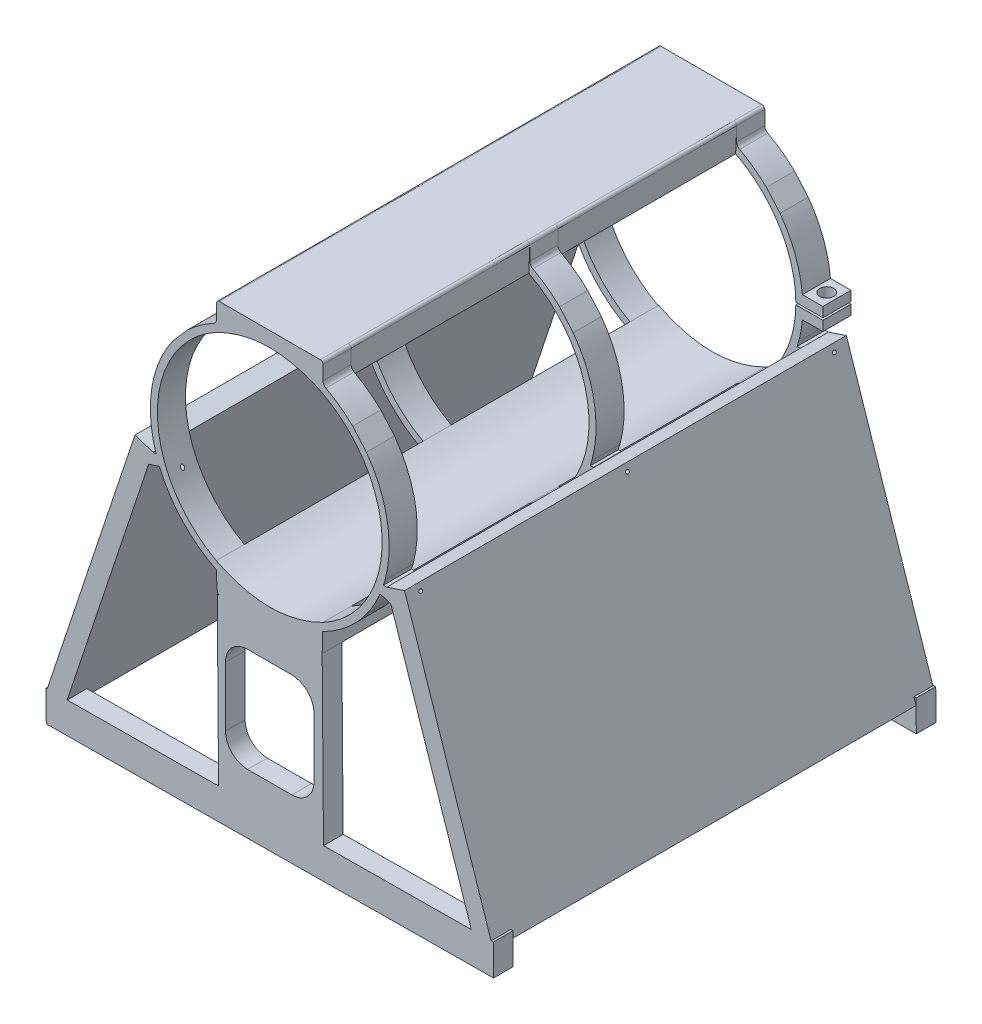
from build123d import *

# Parameters (mm, degrees)
SKETCH1_R                 = 50.8
BOSS_EXTRUDE1_DEPTH       = 12.7
LPATTERN2_COUNT           = 3
LPATTERN2_PITCH           = 93.5
BOSS_EXTRUDE3_DEPTH       = 200
BOSS_EXTRUDE5_DEPTH       = 12.7
SKETCH16_W                = 12.225802464
SKETCH16_H                = 1
CUT_EXTRUDE1_DEPTH        = 12.7
SKETCH17_R                = 3.175
CUT_EXTRUDE2_DEPTH        = 15.7
SKETCH18_W                = 47.42686664
SKETCH18_H                = 8.89
BOSS_EXTRUDE6_DEPTH       = 88.9
CUT_EXTRUDE4_DEPTH        = 18.8
FILLET2_R                 = 10
CUT_EXTRUDE5_DEPTH        = 10
FILLET6_R                 = 0.3
SKETCH26_R                = 0.7935
CUT_EXTRUDE7_DEPTH        = 2
F_1_5MM_START             = 35
F_1_5MM_DOWEL_SLOT2_DEPTH = 7.947903676
LPATTERN4_COUNT           = 3
LPATTERN4_PITCH           = 93.5
MIRROR1_COPY_1_SKETCH_R   = 0.7935
MIRROR1_COPY_1_DEPTH      = 2
MIRROR1_COPY_2_SKETCH_R   = 0.7935
MIRROR1_COPY_2_DEPTH      = 2
MIRROR1_START             = 35
MIRROR1_COPY_3_DEPTH      = 7.947903676
MIRROR1_COPY_4_DEPTH      = 7.947903676
FILLET7_R                 = 10
SKETCH36_W                = 8.89
SKETCH36_H                = 14
BOSS_EXTRUDE8_DEPTH       = 76.75
SKETCH38_W                = 8.89
SKETCH38_H                = 14
BOSS_EXTRUDE10_DEPTH      = 76.75
BOSS_EXTRUDE12_START      = -0.0001
SKETCH40_W                = 199.7
SKETCH40_H                = 127
BOSS_EXTRUDE12_DEPTH      = 8.5001
SKETCH39_W                = 8.89
SKETCH39_H                = 14
BOSS_EXTRUDE14_DEPTH      = 78
SKETCH37_W                = 8.89
SKETCH37_H                = 14
BOSS_EXTRUDE16_DEPTH      = 78
BOSS_EXTRUDE17_DEPTH      = 199.7
SKETCH55_R                = 0.826943886
CUT_EXTRUDE8_DEPTH        = 15
LPATTERN8_COUNT           = 3
LPATTERN8_PITCH           = 93.5
MIRROR6_COPY_1_SKETCH_R   = 0.826943886
MIRROR6_COPY_1_DEPTH      = 15
MIRROR6_COPY_2_SKETCH_R   = 0.826943886
MIRROR6_COPY_2_DEPTH      = 15


with BuildPart() as part:
    # Sketch1 → Boss-Extrude1 (new body)
    with BuildSketch(Plane.XY):
        with BuildLine():
            Line((-24.055294118, 56.216176471), (-24.055294118, 49.866176471))
            ThreePointArc((-24.055294118, 49.866176471), (-24.417262086, 48.559357252), (-25.4, 47.625))
            ThreePointArc((-25.4, 47.625), (-31.759819314, 43.641889305), (-37.505739075, 38.815205287))
            Line((-37.505739075, 38.815205287), (-43.659791369, 31.735205098))
            ThreePointArc((-43.659791369, 31.735205098), (-51.331461425, 16.684774284), (-53.975, 0))
            ThreePointArc((-53.975, 0), (-53.865614909, -3.434553173), (-53.537902992, -6.855185497))
            ThreePointArc((-53.537902992, -6.855185497), (-52.682569376, -11.740847882), (-51.382359151, -16.527364977))
            Line((-51.382359151, -16.527364977), (-52.86890038, -16.527364977))
            Line((-52.86890038, -16.527364977), (-54.75686071, -22.202033459))
            Line((-54.75686071, -22.202033459), (-49.884351703, -20.611940232))
            ThreePointArc((-49.884351703, -20.611940232), (0, -53.975), (49.884351703, -20.611940232))
            Line((49.884351703, -20.611940232), (54.75686071, -22.202033459))
            Line((54.75686071, -22.202033459), (52.86890038, -16.527364977))
            Line((52.86890038, -16.527364977), (51.382359151, -16.527364977))
            Line((51.382359151, -16.527364977), (52.081837881, -14.169784328))
            ThreePointArc((52.081837881, -14.169784328), (52.93636042, -10.537664373), (53.537902992, -6.855185497))
            ThreePointArc((53.537902992, -6.855185497), (53.865614909, -3.434553173), (53.975, 0))
            ThreePointArc((53.975, 0), (51.331461425, 16.684774284), (43.659791369, 31.735205098))
            Line((43.659791369, 31.735205098), (37.505739075, 38.815205287))
            ThreePointArc((37.505739075, 38.815205287), (31.759819314, 43.641889305), (25.4, 47.625))
            ThreePointArc((25.4, 47.625), (24.417262086, 48.559357252), (24.055294118, 49.866176471))
            Line((24.055294118, 49.866176471), (24.055294118, 56.216176471))
            ThreePointArc((24.055294118, 56.216176471), (23.68331973, 57.114202083), (22.785294118, 57.486176471))
            Line((22.785294118, 57.486176471), (-22.785294118, 57.486176471))
            ThreePointArc((-22.785294118, 57.486176471), (-23.68331973, 57.114202083), (-24.055294118, 56.216176471))
        make_face()
        Circle(SKETCH1_R, mode=Mode.SUBTRACT)
    extrude(amount=BOSS_EXTRUDE1_DEPTH)


with BuildPart() as lpattern2_1:
    # LPattern2: pattern copy
    add(part.part.moved(Location(Vector(0, 0, 1) * (1 * LPATTERN2_PITCH))))


with BuildPart() as lpattern2_2:
    # LPattern2: pattern copy
    add(part.part.moved(Location(Vector(0, 0, 1) * (2 * LPATTERN2_PITCH))))


with BuildPart() as part_1:
    add(part.part)

    add(lpattern2_1.part)  # Boss-Extrude3 merges LPattern2_1

    add(lpattern2_2.part)  # Boss-Extrude3 merges LPattern2_2
    # Sketch11 → Boss-Extrude3 (add)
    with BuildSketch(Plane.XY.offset(199.7)):
        with BuildLine():
            Line((23.68331973, -57.114202083), (-22.785294118, -57.486176471))
            Line((-22.785294118, -57.486176471), (-23.68331973, -57.114202083))
            Line((-23.68331973, -57.114202083), (-24.181898326, -49.07426691))
            Line((-24.181898326, -49.07426691), (-24.181898326, -44.675225723))
            add(Edge.make_bspline(
                [(-24.181898326, -44.675225723), (-0.07192549, -56.89053005), (24.055294118, -44.743522715)],
                knots=[0, 0, 0, 1, 1, 1], degree=2))
            Line((24.055294118, -44.743522715), (23.68331973, -57.114202083))
        make_face()
    extrude(amount=-BOSS_EXTRUDE3_DEPTH)

    # Sketch15 → Boss-Extrude5 (add)
    with BuildSketch(Plane(origin=(0, 0, 0), x_dir=(-1, 0, 0), z_dir=(0, 0, -1))):
        Polygon((63.023341774, -4.920509768), (63.023341774, 4.919490232), (53.750341774, 4.919490232), (53.975, 0), (53.750341774, -4.920509768), align=None)
        Polygon((-53.750341774, -4.920509768), (-53.975, 0), (-53.750341774, 4.919490232), (-63.023341774, 4.919490232), (-63.023341774, -4.920509768), align=None)
    extrude(amount=-BOSS_EXTRUDE5_DEPTH)

    # Sketch16 → Cut-Extrude1 (cut)
    with BuildSketch(Plane(origin=(0, 0, 0), x_dir=(-1, 0, 0), z_dir=(0, 0, -1))):
        with Locations((56.910440542, 0)):
            Rectangle(SKETCH16_W, SKETCH16_H)
        with Locations((-56.910440542, 0)):
            Rectangle(SKETCH16_W, SKETCH16_H)
    extrude(amount=-CUT_EXTRUDE1_DEPTH, mode=Mode.SUBTRACT)


with BuildPart() as cut_extrude1_piece_1:
    # of the separate pieces the step leaves, piece 1, a body of its own (cut_extrude1_pieces)
    add(part_1.part.solids().sort_by_distance((63.023341774, -0.5, 0))[0])


with BuildPart() as cut_extrude1_piece_2:
    # of the separate pieces the step leaves, piece 2, a body of its own (cut_extrude1_pieces)
    add(part_1.part.solids().sort_by_distance((37.505739075, 38.815205287, 0))[0])


with BuildPart() as cut_extrude2_tool:
    # Sketch17 → Cut-Extrude2 (new body)
    with BuildSketch(Plane(origin=(0, 4.919490232, 0), x_dir=(1, 0, 0), z_dir=(0, 1, 0))):
        with Locations(Location((-58.388427153, -6.35, 0), (0, 0, 270))):
            Circle(SKETCH17_R)
        with Locations(Location((58.388427153, -6.35, 0), (0, 0, 270))):
            Circle(SKETCH17_R)
    extrude(amount=-CUT_EXTRUDE2_DEPTH)


with BuildPart() as cut_extrude1_piece_1_1:
    add(cut_extrude1_piece_1.part)

    # Cut-Extrude2: cut by cut_extrude2_tool
    add(cut_extrude2_tool.part, mode=Mode.SUBTRACT)

    # Sketch18 → Boss-Extrude6 (add)
    with BuildSketch(Plane(origin=(0.458678929, -57.300111901, 0), x_dir=(0.9999679627099131, 0.00800459579154236, 0), z_dir=(0.00800459579154236, -0.9999679627099132, 0))):
        with Locations((-0.488048441, 4.145)):
            Rectangle(SKETCH18_W, SKETCH18_H)
        with Locations((-0.488048441, 195.255)):
            Rectangle(SKETCH18_W, SKETCH18_H)
    extrude(amount=BOSS_EXTRUDE6_DEPTH)

    # Sketch21 → Cut-Extrude4 (cut)
    with BuildSketch(Plane(origin=(0, 0, -0.3), x_dir=(-1, 0, 0), z_dir=(0, 0, -1))):
        Polygon((0.432638356, -73.499988034), (20.033806895, -73.499988034), (20.033806895, -98.499988034), (20.033806895, -120.499988034), (0.432638356, -120.499988034), (-19.966193105, -120.499988034), (-19.966193105, -98.499988034), (-19.966193105, -73.499988034), align=None)
    extrude(amount=-CUT_EXTRUDE4_DEPTH, mode=Mode.SUBTRACT)

    # Fillet2
    fillet2_edges = [cut_extrude1_piece_1_1.edges().sort_by_distance(p)[0] for p in [
        (19.966193105, -73.499988034, 4.145),
        (-20.033806895, -73.499988034, 4.145),
        (-20.033806895, -120.499988034, 4.145),
        (19.966193105, -120.499988034, 4.145),
    ]]
    fillet(fillet2_edges, radius=FILLET2_R)

    # Sketch22 → Cut-Extrude5 (cut)
    with BuildSketch(Plane.XY.offset(199.7)):
        Polygon((0.783736559, -72.317531488), (19.966193105, -72.317531488), (19.966193105, -98.499988034), (19.966193105, -119.317531488), (0.783736559, -119.317531488), (-20.033806895, -119.317531488), (-20.033806895, -72.317531488), align=None)
    extrude(amount=-CUT_EXTRUDE5_DEPTH, mode=Mode.SUBTRACT)

    # Fillet6
    fillet6_edges = [cut_extrude1_piece_1_1.edges().sort_by_distance(p)[0] for p in [
        (52.86890038, -16.527364977, 99.85),
    ]]
    fillet(fillet6_edges, radius=FILLET6_R)

    # Sketch26 → Cut-Extrude7 (cut)
    with BuildSketch(Plane(origin=(42.649426179, 14.189450006, 0), x_dir=(0, 0, -1), z_dir=(0.9488635217869666, 0.3156865803641875, 0))):
        with Locations(Location((-193.35, -35.362460937, 0), (0, 0, 90))):
            Circle(SKETCH26_R)
    cut_extrude7 = extrude(amount=-CUT_EXTRUDE7_DEPTH, mode=Mode.SUBTRACT)

    # Ø1.5mm Dowel Slot2: read off the stored shape, not the designer's step
    # Ø1.5mm Dowel Slot2 outline → Ø1.5mm Dowel Slot2 (cut)
    with BuildSketch(Plane(origin=(0, 0, 0), x_dir=(-0.3156865803641879, 0.9488635217869665, 0), z_dir=(0.9488635217869666, 0.3156865803641879, 0)).offset(F_1_5MM_START)):
        with BuildLine():
            ThreePointArc((-35.412460937, 194.1), (-36.162460937, 193.35), (-35.412460937, 192.6))
            Line((-35.412460937, 192.6), (-35.312460937, 192.6))
            ThreePointArc((-35.312460937, 192.6), (-34.562460937, 193.35), (-35.312460937, 194.1))
            Line((-35.312460937, 194.1), (-35.412460937, 194.1))
        make_face()
    f_1_5mm_dowel_slot2 = extrude(amount=F_1_5MM_DOWEL_SLOT2_DEPTH, mode=Mode.SUBTRACT)

    # LPattern4: Cut-Extrude7, Ø1.5mm Dowel Slot2 ×3
    with Locations(*[(0, 0, -i * LPATTERN4_PITCH) for i in range(1, LPATTERN4_COUNT)]):
        add(cut_extrude7, mode=Mode.SUBTRACT)
        add(f_1_5mm_dowel_slot2, mode=Mode.SUBTRACT)

    # Mirror1: Cut-Extrude7, Ø1.5mm Dowel Slot2 across plane
    add(cut_extrude7.mirror(Plane(origin=(0, 0, 0), x_dir=(0, 0, 1), z_dir=(1, 0, 0))), mode=Mode.SUBTRACT)
    add(f_1_5mm_dowel_slot2.mirror(Plane(origin=(0, 0, 0), x_dir=(0, 0, 1), z_dir=(1, 0, 0))), mode=Mode.SUBTRACT)

    # Mirror1 copy 1 sketch → Mirror1 copy 1 (cut)
    with BuildSketch(Plane(origin=(-42.649426179, 14.189450006, -93.5), x_dir=(0, 0, -1), z_dir=(-0.9488635217869666, 0.3156865803641875, 0))):
        with Locations((-193.35, 35.362460937)):
            Circle(MIRROR1_COPY_1_SKETCH_R)
    extrude(amount=-MIRROR1_COPY_1_DEPTH, mode=Mode.SUBTRACT)

    # Mirror1 copy 2 sketch → Mirror1 copy 2 (cut)
    with BuildSketch(Plane(origin=(-42.649426179, 14.189450006, -187), x_dir=(0, 0, -1), z_dir=(-0.9488635217869666, 0.3156865803641875, 0))):
        with Locations((-193.35, 35.362460937)):
            Circle(MIRROR1_COPY_2_SKETCH_R)
    extrude(amount=-MIRROR1_COPY_2_DEPTH, mode=Mode.SUBTRACT)

    # Mirror1 copy 3 sketch → Mirror1 copy 3 (cut)
    with BuildSketch(Plane(origin=(0, 0, -93.5), x_dir=(0.3156865803641879, 0.9488635217869665, 0), z_dir=(-0.9488635217869666, 0.3156865803641879, 0)).offset(MIRROR1_START)):
        with BuildLine():
            ThreePointArc((-35.412460937, -194.1), (-36.162460937, -193.35), (-35.412460937, -192.6))
            Line((-35.412460937, -192.6), (-35.312460937, -192.6))
            ThreePointArc((-35.312460937, -192.6), (-34.562460937, -193.35), (-35.312460937, -194.1))
            Line((-35.312460937, -194.1), (-35.412460937, -194.1))
        make_face()
    extrude(amount=MIRROR1_COPY_3_DEPTH, mode=Mode.SUBTRACT)

    # Mirror1 copy 4 sketch → Mirror1 copy 4 (cut)
    with BuildSketch(Plane(origin=(0, 0, -187), x_dir=(0.3156865803641879, 0.9488635217869665, 0), z_dir=(-0.9488635217869666, 0.3156865803641879, 0)).offset(MIRROR1_START)):
        with BuildLine():
            ThreePointArc((-35.412460937, -194.1), (-36.162460937, -193.35), (-35.412460937, -192.6))
            Line((-35.412460937, -192.6), (-35.312460937, -192.6))
            ThreePointArc((-35.312460937, -192.6), (-34.562460937, -193.35), (-35.312460937, -194.1))
            Line((-35.312460937, -194.1), (-35.412460937, -194.1))
        make_face()
    extrude(amount=MIRROR1_COPY_4_DEPTH, mode=Mode.SUBTRACT)

    # Fillet7
    fillet7_edges = [cut_extrude1_piece_1_1.edges().sort_by_distance(p)[0] for p in [
        (-20.033806895, -72.317531488, 195.255),
        (19.966193105, -72.317531488, 195.255),
        (19.966193105, -119.317531488, 195.255),
        (-20.033806895, -119.317531488, 195.255),
    ]]
    fillet(fillet7_edges, radius=FILLET7_R)

    # Sketch36 → Boss-Extrude8 (add)
    with BuildSketch(Plane(origin=(23.2246408, 0.185909818, 0), x_dir=(0, 0, -1), z_dir=(0.9999679627099132, 0.008004595791542361, 0))):
        with Locations((-195.255, -139.2019477)):
            Rectangle(SKETCH36_W, SKETCH36_H)
    extrude(amount=BOSS_EXTRUDE8_DEPTH)

    # Sketch38 → Boss-Extrude10 (add)
    with BuildSketch(Plane(origin=(23.2246408, 0.185909818, 0), x_dir=(0, 0, -1), z_dir=(0.9999679627099132, 0.008004595791542361, 0))):
        with Locations((-4.145, -139.2019477)):
            Rectangle(SKETCH38_W, SKETCH38_H)
    extrude(amount=BOSS_EXTRUDE10_DEPTH)

    # Sketch40 → Boss-Extrude12 (add)
    with BuildSketch(Plane(origin=(-42.649426179, 14.189450006, 0), x_dir=(0, 0, 1), z_dir=(-0.9488635217869668, 0.3156865803641875, 0)).offset(BOSS_EXTRUDE12_START)):
        with Locations((99.85, -95.872216106)):
            Rectangle(SKETCH40_W, SKETCH40_H)
    boss_extrude12 = extrude(amount=BOSS_EXTRUDE12_DEPTH)

    # Mirror4: Boss-Extrude12 across plane
    add(boss_extrude12.mirror(Plane(origin=(0, 0, 0), x_dir=(0, 0, 1), z_dir=(1, 0, 0))))

    # Sketch39 → Boss-Extrude14 (add)
    with BuildSketch(Plane(origin=(-24.200706411, -0.193723079, 0), x_dir=(0, 0, 1), z_dir=(-0.9999679627099132, -0.00800459579154236, 0))):
        with Locations((4.145, -139.2019477)):
            Rectangle(SKETCH39_W, SKETCH39_H)
    extrude(amount=BOSS_EXTRUDE14_DEPTH)

    # Sketch37 → Boss-Extrude16 (add)
    with BuildSketch(Plane(origin=(-24.200706411, -0.193723079, 0), x_dir=(0, 0, 1), z_dir=(-0.9999679627099132, -0.00800459579154236, 0))):
        with Locations((195.255, -139.2019477)):
            Rectangle(SKETCH37_W, SKETCH37_H)
    extrude(amount=BOSS_EXTRUDE16_DEPTH)



with BuildPart() as cut_extrude1_piece_2_1:
    add(cut_extrude1_piece_2.part)

    # Cut-Extrude2: cut by cut_extrude2_tool
    add(cut_extrude2_tool.part, mode=Mode.SUBTRACT)


with BuildPart() as cut_extrude1_piece_1_2:
    add(cut_extrude1_piece_1_1.part)

    add(cut_extrude1_piece_2_1.part)  # Boss-Extrude17 merges Cut-Extrude1 piece 2
    # Sketch46 → Boss-Extrude17 (add)
    with BuildSketch(Plane.XY.offset(199.7)):
        with BuildLine():
            Line((-24.055294118, 56.216176471), (-24.055294118, 44.743522715))
            add(Edge.make_bspline(
                [(-24.055294118, 44.743522715), (-0.253353285, 56.732442848), (23.592929057, 44.98903976)],
                knots=[0, 0, 0, 1, 1, 1], degree=2))
            Line((23.592929057, 44.98903976), (24.055294118, 56.216176471))
            add(Edge.make_bspline(
                [(24.055294118, 56.216176471), (23.946345342, 57.377227695), (22.785294118, 57.486176471)],
                knots=[0, 0, 0, 1, 1, 1], degree=2))
            Line((22.785294118, 57.486176471), (-22.785294118, 57.486176471))
            add(Edge.make_bspline(
                [(-22.785294118, 57.486176471), (-23.946345342, 57.377227695), (-24.055294118, 56.216176471)],
                knots=[0, 0, 0, 1, 1, 1], degree=2))
        make_face()
    extrude(amount=-BOSS_EXTRUDE17_DEPTH)

    # Sketch55 → Cut-Extrude8 (cut)
    with BuildSketch(Plane(origin=(42.649331292, 14.189418437, 0), x_dir=(0, 0, 1), z_dir=(-0.9488635217869668, -0.3156865803641874, 0))):
        with Locations(Location((193.389722472, -35.443398875, 0), (0, 0, 270))):
            Circle(SKETCH55_R)
    cut_extrude8 = extrude(amount=-CUT_EXTRUDE8_DEPTH, mode=Mode.SUBTRACT)

    # LPattern8: Cut-Extrude8 ×3
    with Locations(*[(0, 0, -i * LPATTERN8_PITCH) for i in range(1, LPATTERN8_COUNT)]):
        add(cut_extrude8, mode=Mode.SUBTRACT)

    # Mirror6: Cut-Extrude8 across plane
    add(cut_extrude8.mirror(Plane(origin=(0, 0, 0), x_dir=(0, 0, 1), z_dir=(1, 0, 0))), mode=Mode.SUBTRACT)

    # Mirror6 copy 1 sketch → Mirror6 copy 1 (cut)
    with BuildSketch(Plane(origin=(-42.649331292, 14.189418437, -93.5), x_dir=(0, 0, 1), z_dir=(0.9488635217869668, -0.3156865803641874, 0))):
        with Locations((193.389722472, 35.443398875)):
            Circle(MIRROR6_COPY_1_SKETCH_R)
    extrude(amount=-MIRROR6_COPY_1_DEPTH, mode=Mode.SUBTRACT)

    # Mirror6 copy 2 sketch → Mirror6 copy 2 (cut)
    with BuildSketch(Plane(origin=(-42.649331292, 14.189418437, -187), x_dir=(0, 0, 1), z_dir=(0.9488635217869668, -0.3156865803641874, 0))):
        with Locations((193.389722472, 35.443398875)):
            Circle(MIRROR6_COPY_2_SKETCH_R)
    extrude(amount=-MIRROR6_COPY_2_DEPTH, mode=Mode.SUBTRACT)


solid = cut_extrude1_piece_1_2.part
